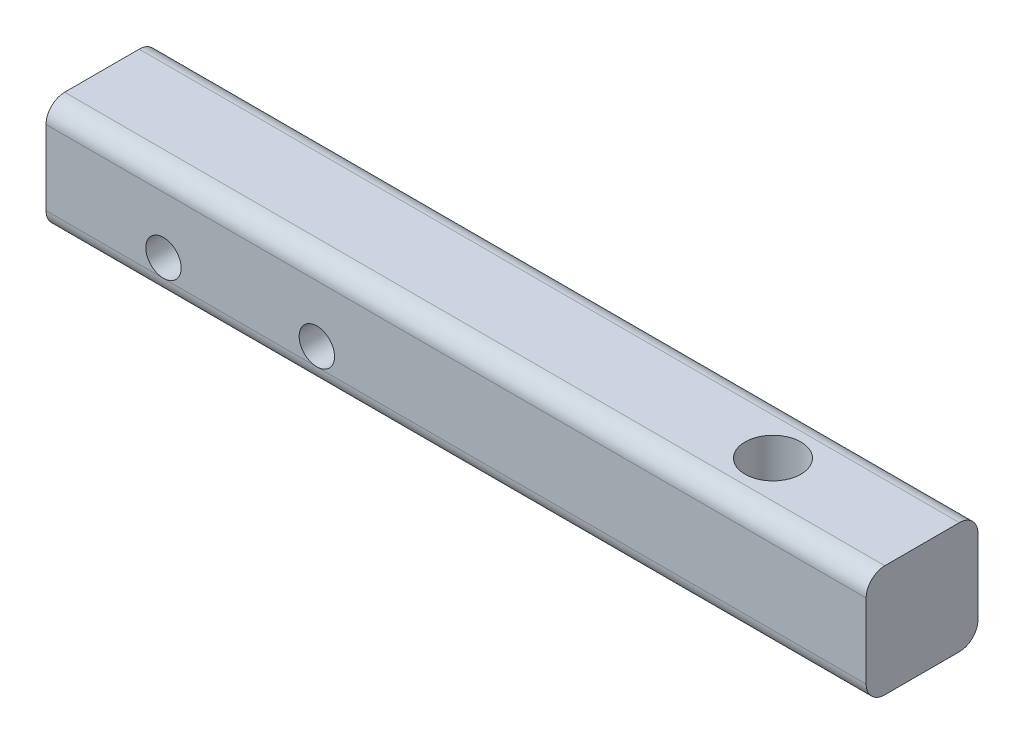
from build123d import *

# Parameters (mm, degrees)
SKETCH1_W           = 19.05
SKETCH1_H           = 19.05
BOSS_EXTRUDE1_DEPTH = 139.7
SKETCH2_R           = 4.7625
CUT_EXTRUDE1_DEPTH  = 142.314253085
SKETCH3_R           = 3.013013481
CUT_EXTRUDE2_DEPTH  = 142.314253085
FILLET1_R           = 3.175


with BuildPart() as part:
    # Sketch1 → Boss-Extrude1 (new body)
    with BuildSketch(Plane(origin=(0, 0, 0), x_dir=(0, 0, -1), z_dir=(1, 0, 0))):
        Rectangle(SKETCH1_W, SKETCH1_H)
    extrude(amount=BOSS_EXTRUDE1_DEPTH)

    # Sketch2 → Cut-Extrude1 (cut, through all)
    with BuildSketch(Plane(origin=(0, 9.525, 0), x_dir=(1, 0, 0), z_dir=(0, 1, 0))):
        with Locations((114.3, 0)):
            Circle(SKETCH2_R)
    extrude(amount=-CUT_EXTRUDE1_DEPTH, mode=Mode.SUBTRACT)

    # Sketch3 → Cut-Extrude2 (cut, through all)
    with BuildSketch(Plane.XY.offset(9.525)):
        with Locations((20.007795207, -3.315616144)):
            Circle(SKETCH3_R)
        with Locations((46.133853757, -3.315616144)):
            Circle(SKETCH3_R)
    extrude(amount=-CUT_EXTRUDE2_DEPTH, mode=Mode.SUBTRACT)

    # Fillet1
    fillet1_edges = [part.edges().sort_by_distance(p)[0] for p in [
        (69.85, -9.525, -9.525),
        (69.85, -9.525, 9.525),
        (69.85, 9.525, -9.525),
        (69.85, 9.525, 9.525),
    ]]
    fillet(fillet1_edges, radius=FILLET1_R)


solid = part.part
